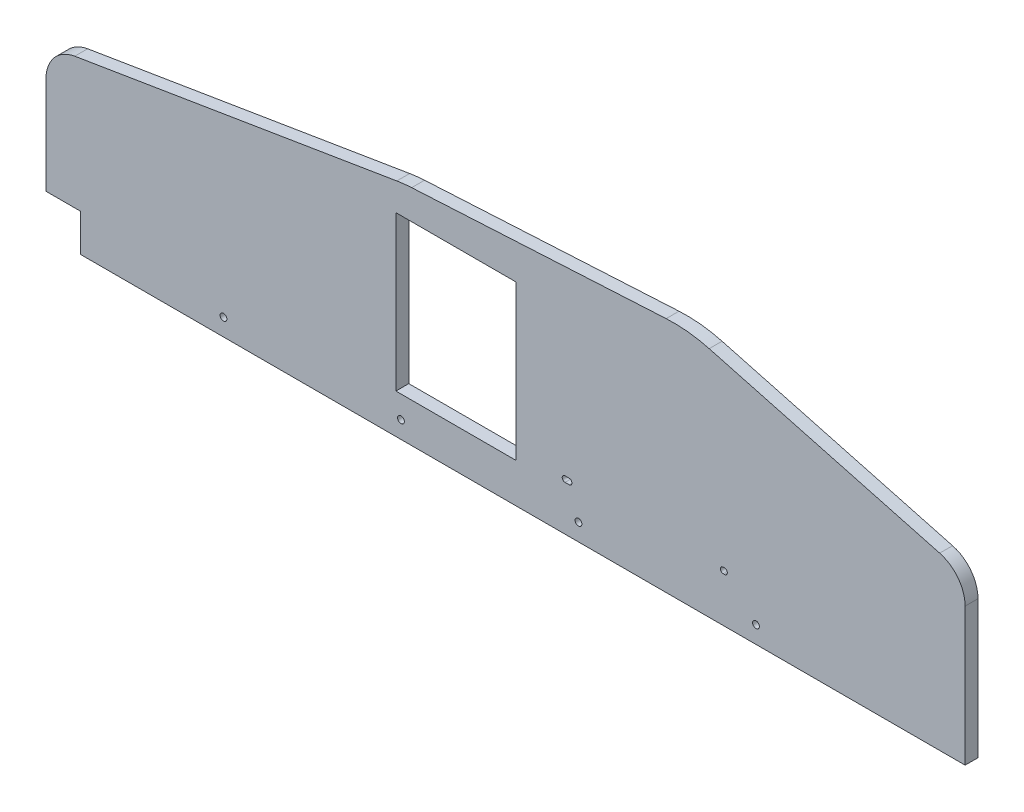
from build123d import *

# Parameters (mm, degrees)
BOSS_EXTRUDE1_DEPTH         = 4.7625
FILLET1_R                   = 25.4
FILLET2_R                   = 101.6
SKETCH3_W                   = 25.4
SKETCH3_H                   = 27.686
CUT_EXTRUDE1_DEPTH          = 383.819793068
SKETCH5_W                   = 88.9
SKETCH5_H                   = 114.3
CUT_EXTRUDE2_DEPTH          = 383.819793068
TAP_DRILL_FOR_M6X1_0_TAP1_D = 5
CUT_EXTRUDE3_DEPTH          = 383.819793068


with BuildPart() as part:
    # Sketch2 → Boss-Extrude1 (new, symmetric)
    with BuildSketch(Plane.XY):
        Polygon((-340, 26.400000032), (-340, 121.400000032), (-75, 165), (135, 176.400000032), (340, 121.400000032), (340, 26.400000032), (340, 0), (-340, 0), align=None)
    extrude(amount=BOSS_EXTRUDE1_DEPTH, both=True)

    # Fillet1
    fillet1_edges = [part.edges().sort_by_distance(p)[0] for p in [
        (340, 121.400000032, 0),
        (-340, 121.400000032, 0),
    ]]
    fillet(fillet1_edges, radius=FILLET1_R)

    # Fillet2
    fillet2_edges = [part.edges().sort_by_distance(p)[0] for p in [
        (-75, 165, 0),
        (135, 176.400000032, 0),
    ]]
    fillet(fillet2_edges, radius=FILLET2_R)

    # Sketch3 → Cut-Extrude1 (cut, through all)
    with BuildSketch(Plane.XY.offset(4.7625)):
        with Locations((-327.3, 13.843)):
            Rectangle(SKETCH3_W, SKETCH3_H)
    extrude(amount=-CUT_EXTRUDE1_DEPTH, mode=Mode.SUBTRACT)

    # Sketch5 → Cut-Extrude2 (cut, through all)
    with BuildSketch(Plane.XY.offset(4.7625)):
        with Locations((-36.66848567, 86.296499999)):
            Rectangle(SKETCH5_W, SKETCH5_H)
    extrude(amount=-CUT_EXTRUDE2_DEPTH, mode=Mode.SUBTRACT)

    # Tap Drill for M6x1.0 Tap1 (through all)
    with Locations(Plane.XY.offset(4.7625)):
        with Locations((-208.682, 12.7), (-77.364, 12.7), (53.954, 12.7), (185.272, 12.7)):
            Hole(TAP_DRILL_FOR_M6X1_0_TAP1_D / 2)

    # Sketch8 → Cut-Extrude3 (cut, through all)
    with BuildSketch(Plane.XY.offset(4.7625)):
        with BuildLine():
            Line((161, 37.4), (162, 37.4))
            ThreePointArc((162, 37.4), (164.1, 35.3), (162, 33.2))
            Line((162, 33.2), (161, 33.2))
            ThreePointArc((161, 33.2), (158.9, 35.3), (161, 37.4))
        make_face()
        with BuildLine():
            Line((47, 33.2), (44, 33.2))
            ThreePointArc((44, 33.2), (41.9, 35.3), (44, 37.4))
            Line((44, 37.4), (47, 37.4))
            ThreePointArc((47, 37.4), (49.1, 35.3), (47, 33.2))
        make_face()
    extrude(amount=-CUT_EXTRUDE3_DEPTH, mode=Mode.SUBTRACT)


solid = part.part
